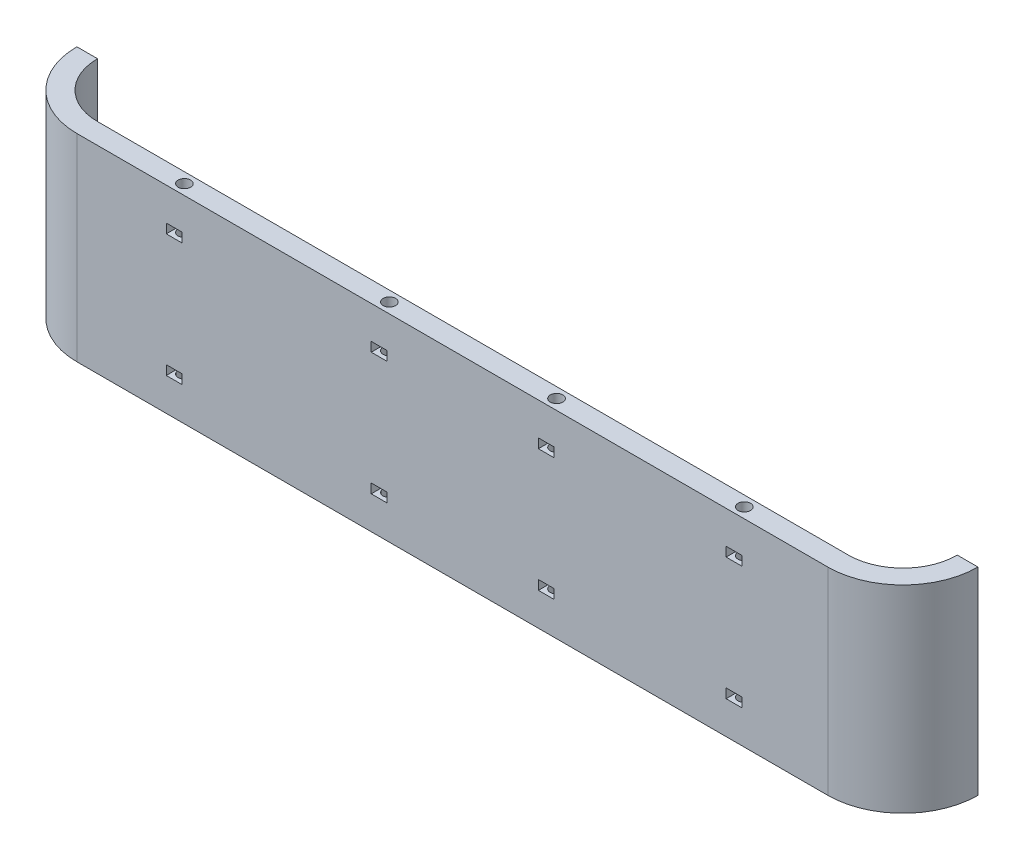
from build123d import *

# Parameters (mm, degrees)
BOSS_EXTRUDE1_DEPTH      = 16
BOSS_EXTRUDE2_DEPTH      = 46.583974855
BOSS_EXTRUDE2_DEPTH_BACK = 46.58397486
SKETCH4_R                = 3.3
CUT_EXTRUDE1_DEPTH       = 32.2
CUT_EXTRUDE1_DEPTH_BACK  = 32.2
SKETCH5_R                = 3.3
SKETCH6_W                = 20
SKETCH6_H                = 11
BOSS_EXTRUDE3_DEPTH      = 30
CUT_EXTRUDE2_DEPTH       = 233.824504724
CUT_EXTRUDE2_DEPTH_BACK  = 233.824504724
SKETCH7_R                = 2
SKETCH8_W                = 40
SKETCH8_H                = 11
CUT_EXTRUDE3_DEPTH       = 40
SKETCH9_R                = 2
CUT_EXTRUDE4_DEPTH       = 40
FILLET1_R                = 20
BOSS_EXTRUDE4_DEPTH      = 52.66666667
SKETCH11_W               = 287.599331825
SKETCH11_H               = 200.78083169
CUT_EXTRUDE5_DEPTH       = 16
SCALE1_START             = 16
SCALE1_DEPTH             = 52.66666667
SCALE1_START_2           = 2.833333333
SCALE1_2_DEPTH           = 79.000000004
SKETCH15_W               = 527.18296214
SKETCH15_H               = 284.392361206
CUT_EXTRUDE9_DEPTH       = 200
SCALE2_SCALE             = 0.8
SKETCH23_R               = 2
CUT_EXTRUDE15_DEPTH      = 175.579201349
SKETCH25_R               = 2
CUT_EXTRUDE18_DEPTH      = 175.579201349
SKETCH28_W               = 5
SKETCH28_H               = 3
CUT_EXTRUDE19_DEPTH      = 164.640269427


# Read off the part's stored shape, not the designer's step: Scale1
with BuildPart() as part:
    # Sketch1 → Boss-Extrude1 (new body)
    with BuildSketch(Plane(origin=(0, 0, 0), x_dir=(1, 0, 0), z_dir=(0, 1, 0))):
        Polygon((-120, -37.5), (-120, -75), (0, -75), (0, 75), (-120, 75), (-120, 37.5), (-220, 37.5), (-220, -37.5), align=None)
    extrude(amount=BOSS_EXTRUDE1_DEPTH)

    # Sketch4 → Boss-Extrude2 (add, two sides: drawn at the far end of the back side and taken through both)
    # profile 1 of 2: a face of its own
    with BuildSketch(Plane.ZY.offset(170).offset(-BOSS_EXTRUDE2_DEPTH_BACK)):
        with BuildLine():
            Line((37.5, 16), (43.5, 16))
            ThreePointArc((43.5, 16), (51.5, 8), (43.5, 0))
            Line((43.5, 0), (37.5, 0))
            Line((37.5, 0), (37.5, 16))
        make_face()
        with Locations((43.5, 8)):
            Circle(SKETCH4_R, mode=Mode.SUBTRACT)
    # profile 2 of 2: a face of its own
    with BuildSketch(Plane.ZY.offset(170).offset(-BOSS_EXTRUDE2_DEPTH_BACK)):
        with BuildLine():
            Line((-37.5, 0), (-43.5, 0))
            ThreePointArc((-43.5, 0), (-51.5, 8), (-43.5, 16))
            Line((-43.5, 16), (-37.5, 16))
            Line((-37.5, 16), (-37.5, 0))
        make_face()
        with Locations((-43.5, 8)):
            Circle(SKETCH4_R, mode=Mode.SUBTRACT)
    extrude(amount=BOSS_EXTRUDE2_DEPTH + BOSS_EXTRUDE2_DEPTH_BACK)

    # Sketch5 → Cut-Extrude1 (cut, two sides: drawn at the far end of the back side and taken through both)
    # profile 1 of 2: a face of its own
    with BuildSketch(Plane.ZY.offset(170).offset(-CUT_EXTRUDE1_DEPTH_BACK)):
        with BuildLine():
            Line((-43.5, 16), (-37.5, 16))
            Line((-37.5, 16), (-37.5, 0))
            Line((-37.5, 0), (-43.5, 0))
            ThreePointArc((-43.5, 0), (-51.5, 8), (-43.5, 16))
        make_face()
        with Locations((-43.5, 8)):
            Circle(SKETCH5_R, mode=Mode.SUBTRACT)
    # profile 2 of 2: a face of its own
    with BuildSketch(Plane.ZY.offset(170).offset(-CUT_EXTRUDE1_DEPTH_BACK)):
        with BuildLine():
            Line((37.5, 0), (43.5, 0))
            ThreePointArc((43.5, 0), (51.5, 8), (43.5, 16))
            Line((43.5, 16), (37.5, 16))
            Line((37.5, 16), (37.5, 0))
        make_face()
        with Locations((43.5, 8)):
            Circle(SKETCH5_R, mode=Mode.SUBTRACT)
    extrude(amount=CUT_EXTRUDE1_DEPTH + CUT_EXTRUDE1_DEPTH_BACK, mode=Mode.SUBTRACT)

    # Sketch6 → Boss-Extrude3 (add)
    with BuildSketch(Plane(origin=(0, 0, 0), x_dir=(0, 0, -1), z_dir=(1, 0, 0))):
        with Locations((-50, 8)):
            Rectangle(SKETCH6_W, SKETCH6_H)
        with Locations((50, 8)):
            Rectangle(SKETCH6_W, SKETCH6_H)
    extrude(amount=BOSS_EXTRUDE3_DEPTH)

    # Sketch7 → Cut-Extrude2 (cut, two sides: drawn at the far end of the back side and taken through both)
    with BuildSketch(Plane(origin=(0, 13.5, 0), x_dir=(1, 0, 0), z_dir=(0, 1, 0)).offset(-CUT_EXTRUDE2_DEPTH_BACK)):
        with Locations(Location((22.5, 50, 0), (0, 0, 270))):
            Circle(SKETCH7_R)
        with Locations(Location((22.5, -50, 0), (0, 0, 270))):
            Circle(SKETCH7_R)
    extrude(amount=CUT_EXTRUDE2_DEPTH + CUT_EXTRUDE2_DEPTH_BACK, mode=Mode.SUBTRACT)

    # Sketch8 → Cut-Extrude3 (cut)
    with BuildSketch(Plane(origin=(0, 0, 0), x_dir=(0, 0, -1), z_dir=(1, 0, 0))):
        with Locations((0, 8)):
            Rectangle(SKETCH8_W, SKETCH8_H)
    extrude(amount=-CUT_EXTRUDE3_DEPTH, mode=Mode.SUBTRACT)

    # Sketch9 → Cut-Extrude4 (cut)
    with BuildSketch(Plane(origin=(0, 16, 0), x_dir=(1, 0, 0), z_dir=(0, 1, 0))):
        with Locations(Location((-32.5, 0, 0), (0, 0, 270))):
            Circle(SKETCH9_R)
    extrude(amount=-CUT_EXTRUDE4_DEPTH, mode=Mode.SUBTRACT)

    # Fillet1
    # the kernel refuses this fillet: 20 mm, written as the material it takes off along each edge
    with BuildSketch(Plane(origin=(-220, -27.947694226, -37.5), x_dir=(0, 0, 1), z_dir=(0, 1, 0))) as fillet1_piece_1:
        with BuildLine():
            CenterArc((11.17907769, 20), FILLET1_R, 236.01651728, 33.98348272)
            Line((0, 3.416025145), (-0.223581554, 3.084345648))
            ThreePointArc((-0.223581554, 3.084345648), (-0.4, 1.708012572), (-0.4, 0))
            Line((-0.4, 0), (0, -0.4))
            Line((0, -0.4), (11.17907769, -0.4))
            Line((11.17907769, -0.4), (11.17907769, 0))
        make_face()
    extrude(amount=71.895388452, mode=Mode.SUBTRACT)
    with BuildSketch(Plane(origin=(-220, -27.947694226, 37.5), x_dir=(1, 0, 0), z_dir=(0, 1, 0))) as fillet1_piece_2:
        with BuildLine():
            CenterArc((20, 11.17907769), FILLET1_R, 180, 33.98348272)
            Line((0, 11.17907769), (-0.4, 11.17907769))
            Line((-0.4, 11.17907769), (-0.4, 0))
            Line((-0.4, 0), (0, -0.4))
            ThreePointArc((0, -0.4), (1.708012572, -0.4), (3.084345648, -0.223581554))
            Line((3.084345648, -0.223581554), (3.416025145, 0))
        make_face()
    extrude(amount=71.895388452, mode=Mode.SUBTRACT)
    with BuildSketch(Plane(origin=(-120, -50, -75), x_dir=(1, 0, 0), z_dir=(0, 1, 0)), Plane(origin=(-120, -50, 75), x_dir=(0, 0, -1), z_dir=(0, 1, 0))) as fillet1_piece_3:
        with BuildLine():
            CenterArc((FILLET1_R, -FILLET1_R), FILLET1_R, 90, 90)
            Line((0, -FILLET1_R), (-FILLET1_R * 0.02, -FILLET1_R))
            Line((-FILLET1_R * 0.02, -FILLET1_R), (-FILLET1_R * 0.02, FILLET1_R * 0.02))
            Line((-FILLET1_R * 0.02, FILLET1_R * 0.02), (FILLET1_R, FILLET1_R * 0.02))
            Line((FILLET1_R, FILLET1_R * 0.02), (FILLET1_R, 0))
        make_face()
    extrude(amount=116, mode=Mode.SUBTRACT)

    # Sketch10 → Boss-Extrude4 (add)
    with BuildSketch(Plane(origin=(0, 16, 0), x_dir=(1, 0, 0), z_dir=(0, 1, 0))):
        with BuildLine():
            Line((0, 69.5), (-100, 69.5))
            ThreePointArc((-100, 69.5), (-110.253048327, 65.253048327), (-114.5, 55))
            Line((-114.5, 55), (-120, 55))
            ThreePointArc((-120, 55), (-114.142135624, 69.142135624), (-100, 75))
            Line((-100, 75), (0, 75))
            Line((0, 75), (100, 75))
            ThreePointArc((100, 75), (114.142135624, 69.142135624), (120, 55))
            Line((120, 55), (114.5, 55))
            ThreePointArc((114.5, 55), (110.253048327, 65.253048327), (100, 69.5))
            Line((100, 69.5), (0, 69.5))
        make_face()
        with BuildLine():
            Line((0, -75), (100, -75))
            ThreePointArc((100, -75), (114.142135624, -69.142135624), (120, -55))
            Line((120, -55), (114.5, -55))
            ThreePointArc((114.5, -55), (110.253048327, -65.253048327), (100, -69.5))
            Line((100, -69.5), (0, -69.5))
            Line((0, -69.5), (-100, -69.5))
            ThreePointArc((-100, -69.5), (-110.253048327, -65.253048327), (-114.5, -55))
            Line((-114.5, -55), (-120, -55))
            ThreePointArc((-120, -55), (-114.142135624, -69.142135624), (-100, -75))
            Line((-100, -75), (0, -75))
        make_face()
    extrude(amount=BOSS_EXTRUDE4_DEPTH)

    # Sketch11 → Cut-Extrude5 (cut)
    with BuildSketch(Plane.XZ):
        with Locations((-109.164099046, 3.949352656)):
            Rectangle(SKETCH11_W, SKETCH11_H)
    extrude(amount=-CUT_EXTRUDE5_DEPTH, mode=Mode.SUBTRACT)


with BuildPart() as cut_extrude5_piece_1:
    # of the separate pieces the step leaves, piece 1, a body of its own (cut_extrude5_pieces)
    add(part.part.solids().sort_by_distance((-100, 16, 75))[0])


with BuildPart() as cut_extrude5_piece_2:
    # of the separate pieces the step leaves, piece 2, a body of its own (cut_extrude5_pieces)
    add(part.part.solids().sort_by_distance((-114.5, 16, -55))[0])


with BuildPart() as scale1_tool:
    # Scale1 outline → Scale1 (new body)
    with BuildSketch(Plane(origin=(0, 0, 0), x_dir=(1, 0, 0), z_dir=(0, 1, 0)).offset(SCALE1_START)):
        with BuildLine():
            Line((104.502391105, -68.783267912), (114.492119434, -68.783267912))
            ThreePointArc((114.492119434, -68.783267912), (118.572054123, -62.421509662), (120, -55))
            Line((120, -55), (114.5, -55))
            ThreePointArc((114.5, -55), (111.737433088, -63.513675146), (104.502391105, -68.783267912))
        make_face()
        with BuildLine():
            Line((-114.492119434, -68.783267912), (-104.502391105, -68.783267912))
            ThreePointArc((-104.502391105, -68.783267912), (-111.737433088, -63.513675146), (-114.5, -55))
            Line((-114.5, -55), (-120, -55))
            ThreePointArc((-120, -55), (-118.572054123, -62.421509662), (-114.492119434, -68.783267912))
        make_face()
        with BuildLine():
            Line((-104.502391105, 68.783267912), (-114.492119434, 68.783267912))
            ThreePointArc((-114.492119434, 68.783267912), (-118.572054123, 62.421509662), (-120, 55))
            Line((-120, 55), (-114.5, 55))
            ThreePointArc((-114.5, 55), (-111.737433088, 63.513675146), (-104.502391105, 68.783267912))
        make_face()
        with BuildLine():
            ThreePointArc((120, 55), (118.572054123, 62.421509662), (114.492119434, 68.783267912))
            Line((114.492119434, 68.783267912), (104.502391105, 68.783267912))
            ThreePointArc((104.502391105, 68.783267912), (111.737433088, 63.513675146), (114.5, 55))
            Line((114.5, 55), (120, 55))
        make_face()
    extrude(amount=SCALE1_DEPTH)


with BuildPart() as cut_extrude5_piece_1_1:
    add(cut_extrude5_piece_1.part)

    # Scale1: cut by scale1_tool
    add(scale1_tool.part, mode=Mode.SUBTRACT)



with BuildPart() as cut_extrude5_piece_2_1:
    add(cut_extrude5_piece_2.part)

    # Scale1: cut by scale1_tool
    add(scale1_tool.part, mode=Mode.SUBTRACT)


with BuildPart() as cut_extrude5_piece_1_2:
    add(cut_extrude5_piece_1_1.part)

    add(cut_extrude5_piece_2_1.part)  # Scale1 2 merges Cut-Extrude5 piece 2
    # Scale1 2 outline → Scale1 2 (add)
    with BuildSketch(Plane(origin=(0, 0, 0), x_dir=(1, 0, 0), z_dir=(0, 1, 0)).offset(SCALE1_START_2)):
        with BuildLine():
            Line((180, -47.033267912), (171.75, -47.033267912))
            ThreePointArc((171.75, -47.033267912), (165.379572491, -62.412840403), (150, -68.783267912))
            Line((150, -68.783267912), (-150, -68.783267912))
            ThreePointArc((-150, -68.783267912), (-165.379572491, -62.412840403), (-171.75, -47.033267912))
            Line((-171.75, -47.033267912), (-180, -47.033267912))
            ThreePointArc((-180, -47.033267912), (-171.213203436, -68.246471348), (-150, -77.033267912))
            Line((-150, -77.033267912), (150, -77.033267912))
            ThreePointArc((150, -77.033267912), (171.213203436, -68.246471348), (180, -47.033267912))
        make_face()
        with BuildLine():
            Line((150, 77.033267912), (-150, 77.033267912))
            ThreePointArc((-150, 77.033267912), (-171.213203436, 68.246471348), (-180, 47.033267912))
            Line((-180, 47.033267912), (-171.75, 47.033267912))
            ThreePointArc((-171.75, 47.033267912), (-165.379572491, 62.412840403), (-150, 68.783267912))
            Line((-150, 68.783267912), (150, 68.783267912))
            ThreePointArc((150, 68.783267912), (165.379572491, 62.412840403), (171.75, 47.033267912))
            Line((171.75, 47.033267912), (180, 47.033267912))
            ThreePointArc((180, 47.033267912), (171.213203436, 68.246471348), (150, 77.033267912))
        make_face()
    extrude(amount=SCALE1_2_DEPTH)

    # Sketch15 → Cut-Extrude9 (cut)
    with BuildSketch(Plane.XY):
        with Locations((-4.944471508, 47.534491158)):
            Rectangle(SKETCH15_W, SKETCH15_H)
    extrude(amount=-CUT_EXTRUDE9_DEPTH, mode=Mode.SUBTRACT)


with BuildPart() as cut_extrude5_piece_1_3:
    # Scale2: scaled about (0, 42.333333335, 70.933464176)
    add(cut_extrude5_piece_1_2.part.scale(SCALE2_SCALE).moved(Location((0, 8.466666667, 14.186692835))))

    # Sketch23 → Cut-Extrude15 (cut, through all)
    with BuildSketch(Plane.XZ.offset(-10.733333333)):
        with Locations(Location((-88.93896071, 72.513307165, 0), (0, 0, 270))):
            Circle(SKETCH23_R)
    extrude(amount=-CUT_EXTRUDE15_DEPTH, mode=Mode.SUBTRACT)

    # Sketch25 → Cut-Extrude18 (cut, through all)
    with BuildSketch(Plane.XZ.offset(-10.733333333)):
        with Locations(Location((-23.42560053, 72.513307165, 0), (0, 0, 270))):
            Circle(SKETCH25_R)
        with Locations(Location((30, 72.513307165, 0), (0, 0, 270))):
            Circle(SKETCH25_R)
        with Locations(Location((-88.93896071, 72.513307165, 0), (0, 0, 270))):
            Circle(SKETCH25_R)
        with Locations(Location((90, 72.513307165, 0), (0, 0, 270))):
            Circle(SKETCH25_R)
    extrude(amount=-CUT_EXTRUDE18_DEPTH, mode=Mode.SUBTRACT)

    # Sketch28 → Cut-Extrude19 (cut, through all)
    with BuildSketch(Plane.XY.offset(75.813307165)):
        with Locations((-88.93896071, 22.733333333)):
            Rectangle(SKETCH28_W, SKETCH28_H)
        with Locations((-23.42560053, 22.733333333)):
            Rectangle(SKETCH28_W, SKETCH28_H)
        with Locations((30, 22.733333333)):
            Rectangle(SKETCH28_W, SKETCH28_H)
        with Locations((90, 22.733333333)):
            Rectangle(SKETCH28_W, SKETCH28_H)
        with Locations((90, 61.933333337)):
            Rectangle(SKETCH28_W, SKETCH28_H)
        with Locations((30, 61.933333337)):
            Rectangle(SKETCH28_W, SKETCH28_H)
        with Locations((-23.42560053, 61.933333337)):
            Rectangle(SKETCH28_W, SKETCH28_H)
        with Locations((-88.93896071, 61.933333337)):
            Rectangle(SKETCH28_W, SKETCH28_H)
    extrude(amount=-CUT_EXTRUDE19_DEPTH, mode=Mode.SUBTRACT)


solid = cut_extrude5_piece_1_3.part
